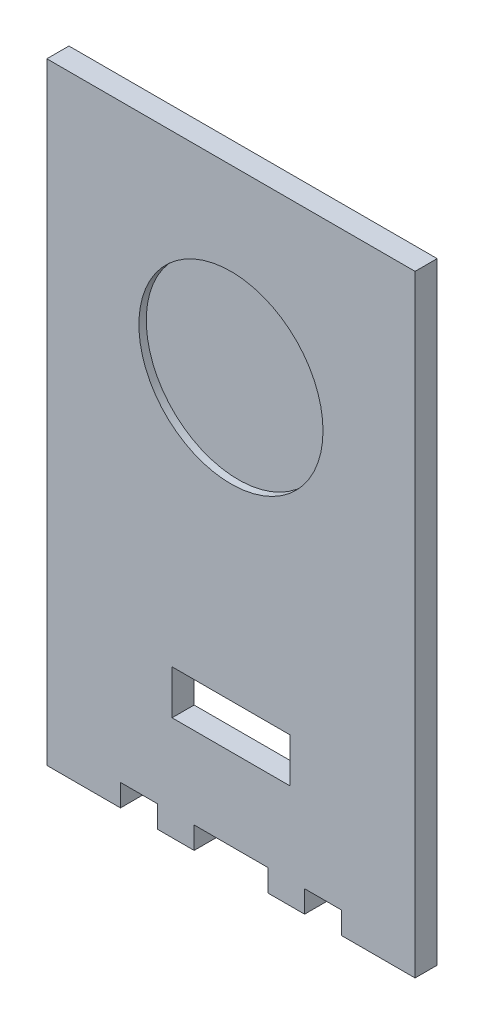
from build123d import *

# Parameters (mm, degrees)
SKETCH1_W            = 16
SKETCH1_H            = 6
BOSS_EXTRUDE1_DEPTH  = 3
MOVE_FACE1_OUTLINE_W = 5
MOVE_FACE1_OUTLINE_H = 53.1
MOVE_FACE1_DEPTH     = 3
MOVE_FACE2_BY        = 30
SKETCH2_R            = 12.5
CUT_EXTRUDE1_DEPTH   = 1


# Read off the part's stored shape, not the designer's step: Move Face1
with BuildPart() as part:
    # Sketch1 → Boss-Extrude1 (new body)
    with BuildSketch(Plane.XY):
        Polygon((-20, 20), (-20, -30.1), (-20, -33.1), (-15, -33.1), (-15, -30.1), (-10, -30.1), (-10, -33.1), (-5, -33.1), (-5, -30.1), (5, -30.1), (5, -33.1), (10, -33.1), (10, -30.1), (15, -30.1), (15, -33.1), (20, -33.1), (20, -30.1), (20, 20), align=None)
        with Locations((0, -16)):
            Rectangle(SKETCH1_W, SKETCH1_H, mode=Mode.SUBTRACT)
    extrude(amount=BOSS_EXTRUDE1_DEPTH)

    # Move Face1 outline → Move Face1 (add)
    with BuildSketch(Plane.XY):
        with Locations((22.5, -6.55)):
            Rectangle(MOVE_FACE1_OUTLINE_W, MOVE_FACE1_OUTLINE_H)
        with Locations((-22.5, -6.55)):
            Rectangle(MOVE_FACE1_OUTLINE_W, MOVE_FACE1_OUTLINE_H)
    extrude(amount=MOVE_FACE1_DEPTH)

    # Move Face2: a face moved outward by 30.0
    extrude(part.faces().sort_by_distance((0, 20, 1.5))[0], amount=MOVE_FACE2_BY, dir=(0, 1, 0))

    # Sketch2 → Cut-Extrude1 (cut)
    with BuildSketch(Plane.XY.offset(3)):
        with Locations((0, 25)):
            Circle(SKETCH2_R)
    extrude(amount=-CUT_EXTRUDE1_DEPTH, mode=Mode.SUBTRACT)


solid = part.part
